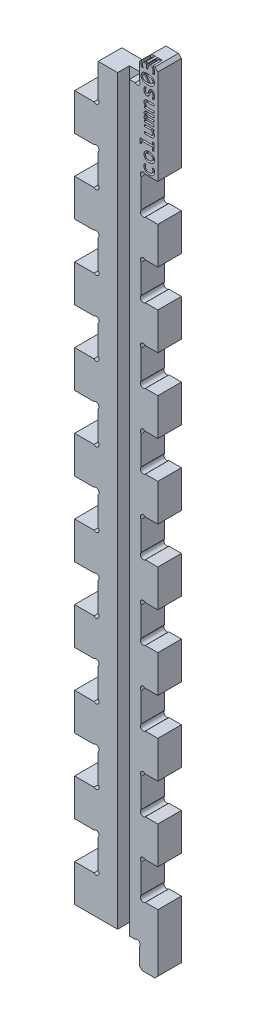
from build123d import *

# Parameters (mm, degrees)
BOSS_EXTRUDE1_DEPTH = 6.35
CUT_EXTRUDE1_DEPTH  = 3.175
CHAMFER1_SIZE       = 0.79375
CUT_EXTRUDE12_DEPTH = 2.54


# Read off the part's stored shape, not the designer's step: Boss-Extrude1
with BuildPart() as part:
    # Boss-Extrude1 outline → Boss-Extrude1 (new body)
    with BuildSketch(Plane.XY):
        with BuildLine():
            Line((22.436796564, 150), (19.069200519, 150))
            ThreePointArc((19.069200519, 150), (17.946668504, 150), (17.946668504, 151.122532015))
            Line((17.946668504, 151.122532015), (17.946668504, 158.877467985))
            ThreePointArc((17.946668504, 158.877467985), (17.946668504, 160), (19.069200519, 160))
            Line((19.069200519, 160), (22.436796564, 160))
            Line((22.436796564, 160), (22.436796564, 170))
            Line((22.436796564, 170), (19.069200519, 170))
            ThreePointArc((19.069200519, 170), (17.946668504, 170), (17.946668504, 171.122532015))
            Line((17.946668504, 171.122532015), (17.946668504, 178.877467985))
            ThreePointArc((17.946668504, 178.877467985), (17.946668504, 180), (19.069200519, 180))
            Line((19.069200519, 180), (22.436796564, 180))
            Line((22.436796564, 180), (22.436796564, 206.35))
            Line((22.436796564, 206.35), (17.436796564, 206.35))
            Line((17.436796564, 206.35), (17.436796564, 201.122532015))
            ThreePointArc((17.436796564, 201.122532015), (17.436796564, 200), (16.314264549, 200))
            Line((16.314264549, 200), (6.35, 200))
            Line((6.35, 200), (6.35, 191.122532015))
            ThreePointArc((6.35, 191.122532015), (6.35, 190), (5.227467985, 190))
            Line((5.227467985, 190), (0, 190))
            Line((0, 190), (0, 180))
            Line((0, 180), (5.227467985, 180))
            ThreePointArc((5.227467985, 180), (6.35, 180), (6.35, 178.877467985))
            Line((6.35, 178.877467985), (6.35, 171.122532015))
            ThreePointArc((6.35, 171.122532015), (6.35, 170), (5.227467985, 170))
            Line((5.227467985, 170), (0, 170))
            Line((0, 170), (0, 160))
            Line((0, 160), (5.227467985, 160))
            ThreePointArc((5.227467985, 160), (6.35, 160), (6.35, 158.877467985))
            Line((6.35, 158.877467985), (6.35, 151.122532015))
            ThreePointArc((6.35, 151.122532015), (6.35, 150), (5.227467985, 150))
            Line((5.227467985, 150), (0, 150))
            Line((0, 150), (0, 140))
            Line((0, 140), (5.227467985, 140))
            ThreePointArc((5.227467985, 140), (6.35, 140), (6.35, 138.877467985))
            Line((6.35, 138.877467985), (6.35, 131.122532015))
            ThreePointArc((6.35, 131.122532015), (6.35, 130), (5.227467985, 130))
            Line((5.227467985, 130), (0, 130))
            Line((0, 130), (0, 120))
            Line((0, 120), (5.227467985, 120))
            ThreePointArc((5.227467985, 120), (6.35, 120), (6.35, 118.877467985))
            Line((6.35, 118.877467985), (6.35, 111.122532015))
            ThreePointArc((6.35, 111.122532015), (6.35, 110), (5.227467985, 110))
            Line((5.227467985, 110), (0, 110))
            Line((0, 110), (0, 100))
            Line((0, 100), (5.227467985, 100))
            ThreePointArc((5.227467985, 100), (6.35, 100), (6.35, 98.877467985))
            Line((6.35, 98.877467985), (6.35, 91.122532015))
            ThreePointArc((6.35, 91.122532015), (6.35, 90), (5.227467985, 90))
            Line((5.227467985, 90), (0, 90))
            Line((0, 90), (0, 80))
            Line((0, 80), (5.227467985, 80))
            ThreePointArc((5.227467985, 80), (6.35, 80), (6.35, 78.877467985))
            Line((6.35, 78.877467985), (6.35, 71.122532015))
            ThreePointArc((6.35, 71.122532015), (6.35, 70), (5.227467985, 70))
            Line((5.227467985, 70), (0, 70))
            Line((0, 70), (0, 60))
            Line((0, 60), (5.227467985, 60))
            ThreePointArc((5.227467985, 60), (6.35, 60), (6.35, 58.877467985))
            Line((6.35, 58.877467985), (6.35, 51.122532015))
            ThreePointArc((6.35, 51.122532015), (6.35, 50), (5.227467985, 50))
            Line((5.227467985, 50), (0, 50))
            Line((0, 50), (0, 40))
            Line((0, 40), (5.227467985, 40))
            ThreePointArc((5.227467985, 40), (6.35, 40), (6.35, 38.877467985))
            Line((6.35, 38.877467985), (6.35, 31.122532015))
            ThreePointArc((6.35, 31.122532015), (6.35, 30), (5.227467985, 30))
            Line((5.227467985, 30), (0, 30))
            Line((0, 30), (0, 20))
            Line((0, 20), (5.227467985, 20))
            ThreePointArc((5.227467985, 20), (6.35, 20), (6.35, 18.877467985))
            Line((6.35, 18.877467985), (6.35, 11.122532015))
            ThreePointArc((6.35, 11.122532015), (6.35, 10), (5.227467985, 10))
            Line((5.227467985, 10), (0, 10))
            Line((0, 10), (0, 0))
            Line((0, 0), (16.314264549, 0))
            ThreePointArc((16.314264549, 0), (17.436796564, 0), (17.436796564, -1.122532015))
            Line((17.436796564, -1.122532015), (17.436796564, -6.35))
            Line((17.436796564, -6.35), (22.436796564, -6.35))
            Line((22.436796564, -6.35), (22.436796564, 10))
            Line((22.436796564, 10), (19.069200519, 10))
            ThreePointArc((19.069200519, 10), (17.946668504, 10), (17.946668504, 11.122532015))
            Line((17.946668504, 11.122532015), (17.946668504, 18.877467985))
            ThreePointArc((17.946668504, 18.877467985), (17.946668504, 20), (19.069200519, 20))
            Line((19.069200519, 20), (22.436796564, 20))
            Line((22.436796564, 20), (22.436796564, 30))
            Line((22.436796564, 30), (19.069200519, 30))
            ThreePointArc((19.069200519, 30), (17.946668504, 30), (17.946668504, 31.122532015))
            Line((17.946668504, 31.122532015), (17.946668504, 38.877467985))
            ThreePointArc((17.946668504, 38.877467985), (17.946668504, 40), (19.069200519, 40))
            Line((19.069200519, 40), (22.436796564, 40))
            Line((22.436796564, 40), (22.436796564, 50))
            Line((22.436796564, 50), (19.069200519, 50))
            ThreePointArc((19.069200519, 50), (17.946668504, 50), (17.946668504, 51.122532015))
            Line((17.946668504, 51.122532015), (17.946668504, 58.877467985))
            ThreePointArc((17.946668504, 58.877467985), (17.946668504, 60), (19.069200519, 60))
            Line((19.069200519, 60), (22.436796564, 60))
            Line((22.436796564, 60), (22.436796564, 70))
            Line((22.436796564, 70), (19.069200519, 70))
            ThreePointArc((19.069200519, 70), (17.946668504, 70), (17.946668504, 71.122532015))
            Line((17.946668504, 71.122532015), (17.946668504, 78.877467985))
            ThreePointArc((17.946668504, 78.877467985), (17.946668504, 80), (19.069200519, 80))
            Line((19.069200519, 80), (22.436796564, 80))
            Line((22.436796564, 80), (22.436796564, 90))
            Line((22.436796564, 90), (19.069200519, 90))
            ThreePointArc((19.069200519, 90), (17.946668504, 90), (17.946668504, 91.122532015))
            Line((17.946668504, 91.122532015), (17.946668504, 98.877467985))
            ThreePointArc((17.946668504, 98.877467985), (17.946668504, 100), (19.069200519, 100))
            Line((19.069200519, 100), (22.436796564, 100))
            Line((22.436796564, 100), (22.436796564, 110))
            Line((22.436796564, 110), (19.069200519, 110))
            ThreePointArc((19.069200519, 110), (17.946668504, 110), (17.946668504, 111.122532015))
            Line((17.946668504, 111.122532015), (17.946668504, 118.877467985))
            ThreePointArc((17.946668504, 118.877467985), (17.946668504, 120), (19.069200519, 120))
            Line((19.069200519, 120), (22.436796564, 120))
            Line((22.436796564, 120), (22.436796564, 130))
            Line((22.436796564, 130), (19.069200519, 130))
            ThreePointArc((19.069200519, 130), (17.946668504, 130), (17.946668504, 131.122532015))
            Line((17.946668504, 131.122532015), (17.946668504, 138.877467985))
            ThreePointArc((17.946668504, 138.877467985), (17.946668504, 140), (19.069200519, 140))
            Line((19.069200519, 140), (22.436796564, 140))
            Line((22.436796564, 140), (22.436796564, 150))
        make_face()
    extrude(amount=BOSS_EXTRUDE1_DEPTH)

    # Sketch2 → Cut-Extrude1 (cut)
    with BuildSketch(Plane.XY.offset(6.35)):
        Polygon((14.771668504, -1.25), (11.596668504, -1.25), (11.596668504, 200), (11.596668504, 201.5875), (14.771668504, 201.5875), (14.771668504, 0), align=None)
    extrude(amount=-CUT_EXTRUDE1_DEPTH, mode=Mode.SUBTRACT)

    # Chamfer1
    chamfer1_edges = [part.edges().sort_by_distance(p)[0] for p in [
        (22.436796564, -6.35, 3.175),
        (17.436796564, -6.35, 3.175),
        (17.436796564, 206.35, 3.175),
        (22.436796564, 206.35, 3.175),
    ]]
    chamfer(chamfer1_edges, length=CHAMFER1_SIZE)

    # Sketch14 → Cut-Extrude12 (cut)
    # profile 1 of 9: a face of its own
    with BuildSketch(Plane.XY.offset(6.35)):
        with BuildLine():
            add(Edge.make_bspline(
                [(21.413507164, 182.485507246), (21.429646152, 182.424711919), (21.462077349, 182.302544081), (21.491344746, 182.113463173), (21.511549887, 181.919789717), (21.513811882, 181.788627363), (21.514956439, 181.722259964)],
                knots=[0, 0, 0, 0, 0.976697248, 1.962667147, 2.969121252, 4, 4, 4, 4], degree=3))
            add(Edge.make_bspline(
                [(21.514956439, 181.722259964), (21.513856896, 181.670971568), (21.511720288, 181.571309086), (21.496171474, 181.426117733), (21.468100047, 181.290207265), (21.430646575, 181.16273982), (21.381129837, 181.044932194), (21.321612414, 180.935690492), (21.249545502, 180.836512901), (21.167985839, 180.745554843), (21.075234468, 180.665092554), (20.972450312, 180.594873737), (20.859204012, 180.536265874), (20.735843311, 180.488477683), (20.602719103, 180.451821331), (20.459645243, 180.424622267), (20.30663064, 180.409018868), (20.201170796, 180.406890726), (20.146976367, 180.405797101)],
                knots=[0, 0, 0, 0, 1.13631222, 2.208056892, 3.229751581, 4.207543962, 5.146802535, 6.055901307, 6.957506756, 7.856829175, 8.757141617, 9.671201812, 10.608488455, 11.575923842, 12.597065045, 13.663569899, 14.799339237, 16, 16, 16, 16], degree=3))
            add(Edge.make_bspline(
                [(20.146976367, 180.405797101), (20.094614731, 180.407038532), (19.991943847, 180.409472734), (19.84148827, 180.427887707), (19.698494066, 180.458688753), (19.563422639, 180.501479962), (19.437057822, 180.555355232), (19.319710197, 180.619914596), (19.211656475, 180.694575413), (19.112855118, 180.778767105), (19.024513864, 180.872527317), (18.947525343, 180.975510658), (18.880221228, 181.086553858), (18.824205356, 181.206095633), (18.779623019, 181.333248263), (18.748120369, 181.467131699), (18.728565171, 181.607287035), (18.726269809, 181.702909174), (18.725101367, 181.751585145)],
                knots=[0, 0, 0, 0, 1.14172334, 2.238695217, 3.299842855, 4.327537934, 5.323891298, 6.290910086, 7.243436865, 8.183333826, 9.116727336, 10.04664683, 10.982384661, 11.943757178, 12.920442466, 13.915445565, 14.938868004, 16, 16, 16, 16], degree=3))
            add(Edge.make_bspline(
                [(18.725101367, 181.751585145), (18.726388209, 181.818727859), (18.728875289, 181.948494565), (18.746046673, 182.137494242), (18.776997368, 182.315988423), (18.810176374, 182.429491842), (18.826550642, 182.485507246)],
                knots=[0, 0, 0, 0, 1.083157279, 2.093417771, 3.059077019, 4, 4, 4, 4], degree=3))
            Line((18.826550642, 182.485507246), (19.283072381, 182.485507246))
            add(Edge.make_bspline(
                [(19.283072381, 182.485507246), (19.258977416, 182.428672532), (19.211243765, 182.316079368), (19.164033448, 182.138882658), (19.136675631, 181.957470002), (19.132837361, 181.834900364), (19.130898468, 181.772984601)],
                knots=[0, 0, 0, 0, 1.008011837, 1.996935199, 2.988156546, 4, 4, 4, 4], degree=3))
            add(Edge.make_bspline(
                [(19.130898468, 181.772984601), (19.13149147, 181.744122764), (19.132673274, 181.686603441), (19.147343327, 181.602138563), (19.167183477, 181.519414748), (19.197803513, 181.440486505), (19.235603895, 181.364796787), (19.282322509, 181.294130788), (19.335064383, 181.226978153), (19.396946446, 181.166145792), (19.46462759, 181.109327572), (19.54086278, 181.06064088), (19.622908437, 181.016289736), (19.712515322, 180.979620743), (19.808454511, 180.948682018), (19.911279726, 180.929370481), (20.019477541, 180.914612476), (20.093818023, 180.913575122), (20.13191749, 180.913043478)],
                knots=[0, 0, 0, 0, 0.936931327, 1.867228869, 2.779398487, 3.697971634, 4.611917788, 5.524087406, 6.446705122, 7.381745884, 8.339342578, 9.313428399, 10.316048635, 11.366925265, 12.455944006, 13.58589901, 14.762774236, 16, 16, 16, 16], degree=3))
            add(Edge.make_bspline(
                [(20.13191749, 180.913043478), (20.171564423, 180.913909478), (20.248353722, 180.915586772), (20.35971831, 180.925471169), (20.463079203, 180.943713113), (20.558878752, 180.969003325), (20.647101159, 181.001378477), (20.72808528, 181.04081261), (20.800333011, 181.089097754), (20.866196596, 181.142821863), (20.923087398, 181.204561397), (20.97348119, 181.271203989), (21.015731225, 181.343874761), (21.049719125, 181.422220986), (21.076897812, 181.505751692), (21.095721959, 181.595012329), (21.106820175, 181.689747148), (21.108366458, 181.754725061), (21.109159338, 181.788043478)],
                knots=[0, 0, 0, 0, 1.272546493, 2.464703921, 3.584083793, 4.637111423, 5.64042409, 6.595989051, 7.520192865, 8.423428206, 9.317262299, 10.207550376, 11.100459029, 12.007863446, 12.943662776, 13.914861663, 14.930813474, 16, 16, 16, 16], degree=3))
            add(Edge.make_bspline(
                [(21.109159338, 181.788043478), (21.10738724, 181.849192548), (21.103877038, 181.970317713), (21.0741389, 182.14858532), (21.027445297, 182.321560971), (20.980509306, 182.430771798), (20.956985425, 182.485507246)],
                knots=[0, 0, 0, 0, 1.019427626, 2.019300384, 3.007291806, 4, 4, 4, 4], degree=3))
            Line((20.956985425, 182.485507246), (21.413507164, 182.485507246))
        make_face()
    # profile 2 of 9: a face of its own
    with BuildSketch(Plane.XY.offset(6.35)):
        with BuildLine():
            add(Edge.make_bspline(
                [(20.098629446, 185.782608696), (20.149928894, 185.78158166), (20.250692643, 185.779564329), (20.398344109, 185.762571062), (20.539438263, 185.735005856), (20.673327516, 185.696146129), (20.799657147, 185.647454074), (20.916719521, 185.587440787), (21.024977872, 185.51880535), (21.123161125, 185.439654611), (21.211337395, 185.351428085), (21.289883784, 185.254322042), (21.356403784, 185.146850926), (21.41367794, 185.031412914), (21.459058863, 184.907070692), (21.491342659, 184.774462957), (21.511747676, 184.633747926), (21.51387058, 184.537020889), (21.514956439, 184.48754529)],
                knots=[0, 0, 0, 0, 1.137682146, 2.234665757, 3.292064677, 4.323284341, 5.323444728, 6.290591528, 7.236753627, 8.16208614, 9.082058246, 9.999151167, 10.926004237, 11.880028938, 12.853388225, 13.855469823, 14.903079009, 16, 16, 16, 16], degree=3))
            add(Edge.make_bspline(
                [(21.514956439, 184.48754529), (21.5139342, 184.440206537), (21.511940151, 184.347864322), (21.495137476, 184.212998505), (21.466723584, 184.085847668), (21.427094603, 183.966623013), (21.376972909, 183.855391745), (21.316025022, 183.75282742), (21.243689638, 183.659398891), (21.162013437, 183.573784384), (21.068610827, 183.498620736), (20.965241844, 183.432262247), (20.851690878, 183.375046764), (20.727139385, 183.328667436), (20.593327029, 183.291272644), (20.449223764, 183.265523075), (20.295813508, 183.249539562), (20.190080229, 183.247448639), (20.135880352, 183.246376812)],
                knots=[0, 0, 0, 0, 1.077482312, 2.101810833, 3.088247346, 4.039279708, 4.957210705, 5.860841599, 6.748700475, 7.642023149, 8.548532111, 9.471180557, 10.434177725, 11.437361354, 12.492450218, 13.593169009, 14.76623572, 16, 16, 16, 16], degree=3))
            add(Edge.make_bspline(
                [(20.135880352, 183.246376812), (20.084580452, 183.247395528), (19.984078398, 183.249391303), (19.836950248, 183.266405431), (19.69665767, 183.294006048), (19.563750311, 183.33267469), (19.438582337, 183.38168436), (19.322757104, 183.441640003), (19.214718157, 183.509506335), (19.116963101, 183.588602567), (19.028385723, 183.676764091), (18.950525738, 183.774836569), (18.88290835, 183.881696915), (18.825325086, 183.997196574), (18.780139491, 184.121591214), (18.748956682, 184.254642184), (18.728242793, 184.395222123), (18.726164439, 184.491959387), (18.725101367, 184.541440217)],
                knots=[0, 0, 0, 0, 1.140165783, 2.23370814, 3.287654293, 4.315485483, 5.306894427, 6.270924538, 7.211041269, 8.138393845, 9.060374312, 9.984055593, 10.916064858, 11.866908198, 12.847911069, 13.850788169, 14.900684357, 16, 16, 16, 16], degree=3))
            add(Edge.make_bspline(
                [(18.725101367, 184.541440217), (18.726138595, 184.588774494), (18.728161885, 184.681107979), (18.744724575, 184.815779693), (18.773770338, 184.942382546), (18.811858811, 185.062160689), (18.863282967, 185.172947018), (18.923022902, 185.276442429), (18.995651008, 185.369299477), (19.076394312, 185.455189983), (19.169154124, 185.530609907), (19.272314075, 185.596456426), (19.38534147, 185.654179465), (19.509549702, 185.700111985), (19.643231015, 185.737977967), (19.786910809, 185.763211548), (19.939739193, 185.779524083), (20.044689945, 185.781561542), (20.098629446, 185.782608696)],
                knots=[0, 0, 0, 0, 1.079837612, 2.106405242, 3.089117945, 4.040340163, 4.968261396, 5.870792832, 6.760592503, 7.651698004, 8.555516875, 9.480182165, 10.439904144, 11.445280661, 12.496869516, 13.605924118, 14.769563276, 16, 16, 16, 16], degree=3))
        make_face()
        with BuildLine():
            add(Edge.make_bspline(
                [(20.118443758, 185.275362319), (20.078523368, 185.274888358), (20.001444505, 185.273973228), (19.889491628, 185.263133431), (19.785326787, 185.247065472), (19.688552654, 185.224039838), (19.599788238, 185.194740572), (19.518226239, 185.16018196), (19.444874103, 185.118545277), (19.37895209, 185.071874763), (19.320050824, 185.019875023), (19.269457285, 184.961901027), (19.226023416, 184.898753776), (19.191173469, 184.830177651), (19.164312848, 184.757214262), (19.145272418, 184.679854827), (19.13307589, 184.598628955), (19.131631185, 184.542805133), (19.130898468, 184.514492754)],
                knots=[0, 0, 0, 0, 1.356519224, 2.619186811, 3.819509988, 4.936913966, 5.996184945, 6.99377994, 7.942819649, 8.857324597, 9.735111911, 10.606953056, 11.466309403, 12.333838493, 13.214652511, 14.103305864, 15.038046444, 16, 16, 16, 16], degree=3))
            add(Edge.make_bspline(
                [(19.130898468, 184.514492754), (19.131564114, 184.481909957), (19.132855377, 184.418703668), (19.14987618, 184.327967971), (19.173429934, 184.243450279), (19.209713079, 184.167355229), (19.254151625, 184.098492957), (19.304575528, 184.035387152), (19.363437182, 183.979929015), (19.427441679, 183.929513333), (19.498577165, 183.886852233), (19.57499167, 183.850674576), (19.656379806, 183.81909919), (19.74314869, 183.795522138), (19.833556393, 183.775874383), (19.926720155, 183.764445356), (20.021801413, 183.754388409), (20.085918653, 183.753880724), (20.118443758, 183.753623188)],
                knots=[0, 0, 0, 0, 1.110637689, 2.154489307, 3.141878424, 4.098089287, 5.018763327, 5.935719245, 6.84787245, 7.773348928, 8.712219521, 9.67229302, 10.657166387, 11.687883328, 12.738569762, 13.812532751, 14.89035145, 16, 16, 16, 16], degree=3))
            add(Edge.make_bspline(
                [(20.118443758, 183.753623188), (20.158361186, 183.754125952), (20.235960619, 183.755103325), (20.348215106, 183.765640971), (20.452846842, 183.782111664), (20.549900727, 183.80496103), (20.639272156, 183.834070394), (20.721225789, 183.868971805), (20.794727265, 183.910377055), (20.861682965, 183.956152969), (20.919367282, 184.009213362), (20.971016369, 184.066016615), (21.012918828, 184.129577947), (21.047931694, 184.197324717), (21.076394791, 184.269890718), (21.094373111, 184.347647216), (21.107184143, 184.429531478), (21.10848861, 184.485641963), (21.109159338, 184.514492754)],
                knots=[0, 0, 0, 0, 1.353436926, 2.63107981, 3.819827699, 4.943407898, 6.008783481, 7.004111729, 7.958805456, 8.866070606, 9.747847192, 10.610990163, 11.463369748, 12.320960703, 13.194550705, 14.098580282, 15.02233135, 16, 16, 16, 16], degree=3))
            add(Edge.make_bspline(
                [(21.109159338, 184.514492754), (21.108376586, 184.547053657), (21.106859225, 184.610172895), (21.091439129, 184.701238881), (21.066573916, 184.785234151), (21.029955864, 184.861122204), (20.986186379, 184.930419732), (20.935401457, 184.993512186), (20.876922388, 185.049189243), (20.81209752, 185.09845625), (20.741774437, 185.142334054), (20.665020735, 185.178248247), (20.583685241, 185.209867552), (20.496679882, 185.233682095), (20.406121286, 185.252564541), (20.312432858, 185.266142893), (20.216338189, 185.274159571), (20.151218551, 185.274959642), (20.118443758, 185.275362319)],
                knots=[0, 0, 0, 0, 1.10814016, 2.148127254, 3.135881691, 4.081802165, 5.007999381, 5.922893309, 6.832995325, 7.750893548, 8.692352109, 9.650266659, 10.632925307, 11.66132444, 12.718455334, 13.782343566, 14.883850839, 16, 16, 16, 16], degree=3))
        make_face(mode=Mode.SUBTRACT)
    # profile 3 of 9: a face of its own
    with BuildSketch(Plane.XY.offset(6.35)):
        Polygon((18.065681077, 187.304347826), (18.065681077, 186.543478261), (17.659883975, 186.543478261), (17.659883975, 187.811594203), (21.0584347, 187.811594203), (21.0584347, 188.572463768), (21.464231801, 188.572463768), (21.464231801, 186.442028986), (21.0584347, 186.442028986), (21.0584347, 187.304347826), align=None)
    # profile 4 of 9: a face of its own
    with BuildSketch(Plane.XY.offset(6.35)):
        with BuildLine():
            Line((21.464231801, 191.565217391), (21.464231801, 191.110280797))
            Line((21.464231801, 191.110280797), (21.030694664, 191.092844203))
            add(Edge.make_bspline(
                [(21.030694664, 191.092844203), (21.053299903, 191.073461681), (21.09705005, 191.035948775), (21.158359007, 190.978543884), (21.213789088, 190.922632447), (21.277951941, 190.850952495), (21.347811564, 190.763927611), (21.413429745, 190.656342716), (21.463372308, 190.549506837), (21.494048452, 190.440155251), (21.512139851, 190.328108991), (21.514003687, 190.251996046), (21.514956439, 190.213088768)],
                knots=[0, 0, 0, 0, 0.857041526, 1.65871694, 2.416941668, 3.122378847, 4.427667761, 5.622358466, 6.742009012, 7.810626984, 8.880840251, 10, 10, 10, 10], degree=3))
            add(Edge.make_bspline(
                [(21.514956439, 190.213088768), (21.514186608, 190.179767566), (21.512697402, 190.115309034), (21.50147804, 190.021643699), (21.482957991, 189.934386696), (21.455466803, 189.853565197), (21.421686776, 189.778503917), (21.379361301, 189.709754928), (21.329025215, 189.647701481), (21.2714755, 189.591606153), (21.206235371, 189.542355078), (21.132818293, 189.500108133), (21.052217238, 189.46367016), (20.963366924, 189.434614301), (20.867204584, 189.411400603), (20.762896312, 189.396451206), (20.651022625, 189.385413492), (20.573675008, 189.38451944), (20.533751729, 189.384057971)],
                knots=[0, 0, 0, 0, 1.087785528, 2.104277609, 3.075507797, 3.994819673, 4.886518758, 5.757958902, 6.622884796, 7.48914323, 8.375946856, 9.284388073, 10.249623431, 11.258952501, 12.33231048, 13.475466952, 14.696952255, 16, 16, 16, 16], degree=3))
            Line((20.533751729, 189.384057971), (18.775826004, 189.384057971))
            Line((18.775826004, 189.384057971), (18.775826004, 189.891304348))
            Line((18.775826004, 189.891304348), (20.491745388, 189.891304348))
            add(Edge.make_bspline(
                [(20.491745388, 189.891304348), (20.516591582, 189.891521189), (20.565029673, 189.891943925), (20.635128487, 189.897712942), (20.700511233, 189.906260474), (20.760880419, 189.918127928), (20.816713889, 189.932890876), (20.867721251, 189.951922659), (20.913742556, 189.974718743), (20.954635234, 190.001431315), (20.99137069, 190.030301054), (21.022698058, 190.063681857), (21.049925424, 190.099801399), (21.071051105, 190.140263007), (21.089202283, 190.183205509), (21.100508892, 190.230322405), (21.107957014, 190.280745511), (21.108749683, 190.31556494), (21.109159338, 190.333559783)],
                knots=[0, 0, 0, 0, 1.379482231, 2.689324916, 3.903207566, 5.03979223, 6.103994373, 7.10685688, 8.058278418, 8.949535843, 9.815682373, 10.645916616, 11.485176811, 12.318904069, 13.174422631, 14.067610232, 15.001332013, 16, 16, 16, 16], degree=3))
            add(Edge.make_bspline(
                [(21.109159338, 190.333559783), (21.107955241, 190.360618186), (21.105563726, 190.414360176), (21.085337666, 190.494976879), (21.049231493, 190.576304059), (20.993289282, 190.660049607), (20.918723086, 190.749633025), (20.8400473, 190.824631321), (20.767507711, 190.890565505), (20.703454547, 190.943812004), (20.632563823, 191.000612027), (20.582213534, 191.038305046), (20.555943758, 191.057971014)],
                knots=[0, 0, 0, 0, 0.858155544, 1.704423788, 2.62077838, 3.670024691, 4.89106605, 6.314526741, 7.116271201, 8.003329472, 8.958256453, 10, 10, 10, 10], degree=3))
            Line((20.555943758, 191.057971014), (18.775826004, 191.057971014))
            Line((18.775826004, 191.057971014), (18.775826004, 191.565217391))
            Line((18.775826004, 191.565217391), (21.464231801, 191.565217391))
        make_face()
    # profile 5 of 9: a face of its own
    with BuildSketch(Plane.XY.offset(6.35)):
        with BuildLine():
            Line((21.464231801, 194.304347826), (19.546206439, 194.304347826))
            add(Edge.make_bspline(
                [(19.546206439, 194.304347826), (19.508148611, 194.303950382), (19.439630536, 194.303234837), (19.347273139, 194.297078765), (19.274029528, 194.287752634), (19.218032922, 194.272555985), (19.176230475, 194.252750242), (19.147765599, 194.226697059), (19.13318363, 194.192800558), (19.131697314, 194.16895368), (19.130898468, 194.156136775)],
                knots=[0, 0, 0, 0, 1.876556353, 3.378491021, 4.56325376, 5.511765752, 6.228468968, 6.827369418, 7.36975005, 8, 8, 8, 8], degree=3))
            add(Edge.make_bspline(
                [(19.130898468, 194.156136775), (19.132416276, 194.140481198), (19.135504649, 194.108625861), (19.163226718, 194.06354791), (19.208033838, 194.021311398), (19.257405643, 193.986059191), (19.306710104, 193.955775518), (19.351906147, 193.931869776), (19.402113899, 193.905220163), (19.458489596, 193.87764161), (19.521440983, 193.848193142), (19.591241491, 193.816921356), (19.667092461, 193.781465015), (19.720508956, 193.758388311), (19.748312417, 193.746376812)],
                knots=[0, 0, 0, 0, 0.729562897, 1.484485128, 2.413589845, 3.61111441, 4.323305539, 5.12759957, 6.009182577, 6.990408454, 8.07175806, 9.269988125, 10.579019869, 12, 12, 12, 12], degree=3))
            Line((19.748312417, 193.746376812), (21.464231801, 193.746376812))
            Line((21.464231801, 193.746376812), (21.464231801, 193.239130435))
            Line((21.464231801, 193.239130435), (19.596138504, 193.239130435))
            add(Edge.make_bspline(
                [(19.596138504, 193.239130435), (19.572887814, 193.238948154), (19.529023114, 193.238604264), (19.466412752, 193.236864221), (19.410865821, 193.235009783), (19.34925788, 193.22958629), (19.285434992, 193.222747542), (19.22333188, 193.20745675), (19.177678642, 193.18755944), (19.147432969, 193.159916552), (19.133580881, 193.125051578), (19.131817955, 193.101056665), (19.130898468, 193.088541667)],
                knots=[0, 0, 0, 0, 1.29831334, 2.449394988, 3.497764777, 4.400691891, 5.902997146, 7.076641074, 7.960813511, 8.659813197, 9.301000314, 10, 10, 10, 10], degree=3))
            add(Edge.make_bspline(
                [(19.130898468, 193.088541667), (19.132093623, 193.07430847), (19.134535245, 193.045230975), (19.157304813, 193.002462838), (19.197835341, 192.961046157), (19.244595333, 192.926767623), (19.292626035, 192.896982157), (19.336947371, 192.87191926), (19.38723111, 192.844601369), (19.444399085, 192.816208153), (19.508980077, 192.786048363), (19.581496444, 192.753561611), (19.661965228, 192.717901721), (19.718689948, 192.69376432), (19.748312417, 192.68115942)],
                knots=[0, 0, 0, 0, 0.664834964, 1.358214545, 2.218452452, 3.369512681, 4.07160188, 4.871606883, 5.759566004, 6.758032602, 7.867786569, 9.105782755, 10.488597914, 12, 12, 12, 12], degree=3))
            Line((19.748312417, 192.68115942), (21.464231801, 192.68115942))
            Line((21.464231801, 192.68115942), (21.464231801, 192.173913043))
            Line((21.464231801, 192.173913043), (18.775826004, 192.173913043))
            Line((18.775826004, 192.173913043), (18.775826004, 192.595561594))
            Line((18.775826004, 192.595561594), (19.287035243, 192.620923913))
            add(Edge.make_bspline(
                [(19.287035243, 192.620923913), (19.239508284, 192.643698792), (19.151017248, 192.686103623), (19.030355218, 192.752493067), (18.931201785, 192.81937967), (18.853193606, 192.889918223), (18.794132149, 192.964139784), (18.753059053, 193.044008919), (18.729508641, 193.131060837), (18.726598361, 193.191432391), (18.725101367, 193.222486413)],
                knots=[0, 0, 0, 0, 1.442431336, 2.685680846, 3.766898407, 4.708676083, 5.553507341, 6.349116777, 7.150815901, 8, 8, 8, 8], degree=3))
            add(Edge.make_bspline(
                [(18.725101367, 193.222486413), (18.726525437, 193.257029922), (18.729248025, 193.323071419), (18.756675793, 193.415390003), (18.802203914, 193.494632889), (18.855681121, 193.547834562), (18.905802649, 193.583556282), (18.949375973, 193.606565688), (18.997418602, 193.626218098), (19.050570402, 193.642009327), (19.10802793, 193.65466786), (19.170597505, 193.663055775), (19.237784433, 193.668894836), (19.284379465, 193.669292159), (19.3084347, 193.669497283)],
                knots=[0, 0, 0, 0, 1.480005216, 2.829526133, 4.090306251, 5.365750341, 6.033031342, 6.728361887, 7.476213735, 8.258546705, 9.10632501, 9.999921807, 10.967436031, 12, 12, 12, 12], degree=3))
            add(Edge.make_bspline(
                [(19.3084347, 193.669497283), (19.264458674, 193.690908716), (19.1805232, 193.731775955), (19.062755859, 193.793957451), (18.961358617, 193.859047027), (18.876046478, 193.928429936), (18.810281084, 194.006587204), (18.768088639, 194.077489897), (18.746643666, 194.138882772), (18.73326162, 194.187717018), (18.726474098, 194.24022251), (18.725566587, 194.276328041), (18.725101367, 194.294836957)],
                knots=[0, 0, 0, 0, 1.60985852, 3.072679605, 4.379817855, 5.571026594, 6.67542271, 7.726937151, 8.263282642, 8.811616546, 9.390794494, 10, 10, 10, 10], degree=3))
            add(Edge.make_bspline(
                [(18.725101367, 194.294836957), (18.725769095, 194.31573187), (18.727068354, 194.356388978), (18.7354553, 194.415625799), (18.751480435, 194.47037016), (18.773330217, 194.521017425), (18.79987008, 194.568229819), (18.834169021, 194.610620973), (18.8736026, 194.649805766), (18.920250082, 194.683658591), (18.972202161, 194.714109516), (19.030470465, 194.740140247), (19.094954046, 194.762245563), (19.16549496, 194.780248188), (19.24176127, 194.794342967), (19.324026574, 194.804888752), (19.41246534, 194.809853917), (19.473549809, 194.811002815), (19.504992671, 194.811594203)],
                knots=[0, 0, 0, 0, 0.945901948, 1.840526258, 2.699599065, 3.519232278, 4.333526944, 5.142182627, 5.979336698, 6.84272648, 7.743086642, 8.701080884, 9.725927667, 10.825164815, 11.993149719, 13.234608006, 14.576531152, 16, 16, 16, 16], degree=3))
            Line((19.504992671, 194.811594203), (21.464231801, 194.811594203))
            Line((21.464231801, 194.811594203), (21.464231801, 194.304347826))
        make_face()
    # profile 6 of 9: a face of its own
    with BuildSketch(Plane.XY.offset(6.35)):
        with BuildLine():
            Line((18.775826004, 195.369565217), (18.775826004, 195.821331522))
            Line((18.775826004, 195.821331522), (19.209363142, 195.841938406))
            add(Edge.make_bspline(
                [(19.209363142, 195.841938406), (19.186710248, 195.861003344), (19.142744173, 195.898005702), (19.081997904, 195.955486797), (19.026054246, 196.010602059), (18.961916674, 196.082184001), (18.893862846, 196.170444954), (18.826169895, 196.276296402), (18.777671642, 196.383710512), (18.745726298, 196.492883639), (18.728163923, 196.604863924), (18.726128039, 196.680420996), (18.725101367, 196.718523551)],
                knots=[0, 0, 0, 0, 0.854410729, 1.658290848, 2.413189534, 3.120566751, 4.430777517, 5.626275647, 6.738912042, 7.819923861, 8.900612878, 10, 10, 10, 10], degree=3))
            add(Edge.make_bspline(
                [(18.725101367, 196.718523551), (18.725890025, 196.751841384), (18.727421862, 196.816555763), (18.738451724, 196.910525856), (18.757329497, 196.998196913), (18.78419985, 197.079648086), (18.819360375, 197.154483393), (18.861422335, 197.223472345), (18.911842027, 197.28548985), (18.969373934, 197.341586065), (19.035072753, 197.391227183), (19.108930293, 197.433408959), (19.189952857, 197.470504106), (19.278703687, 197.500215412), (19.375491807, 197.523441596), (19.479817057, 197.538209367), (19.591672051, 197.549416128), (19.668759142, 197.550278171), (19.708683794, 197.550724638)],
                knots=[0, 0, 0, 0, 1.084895162, 2.107229392, 3.075878915, 4.000906046, 4.893849023, 5.762973654, 6.625601345, 7.489558035, 8.374005326, 9.299232485, 10.254066813, 11.271611206, 12.342117155, 13.490741827, 14.700414596, 16, 16, 16, 16], degree=3))
            Line((19.708683794, 197.550724638), (21.464231801, 197.550724638))
            Line((21.464231801, 197.550724638), (21.464231801, 197.043478261))
            Line((21.464231801, 197.043478261), (19.74910499, 197.043478261))
            add(Edge.make_bspline(
                [(19.74910499, 197.043478261), (19.723730974, 197.043265254), (19.674502152, 197.042851992), (19.603339802, 197.037091144), (19.537196421, 197.028436739), (19.475867291, 197.016915169), (19.419763259, 197.000971658), (19.368505609, 196.982341933), (19.323034805, 196.958989105), (19.282294054, 196.932837531), (19.24610001, 196.903333387), (19.215007947, 196.870087301), (19.189622163, 196.832849132), (19.167717404, 196.793000387), (19.151289444, 196.749179056), (19.13943576, 196.702129404), (19.132131947, 196.651646463), (19.131318738, 196.61683555), (19.130898468, 196.598845109)],
                knots=[0, 0, 0, 0, 1.402829076, 2.721667091, 3.944869442, 5.09095765, 6.168609952, 7.167208006, 8.101539423, 8.989006971, 9.840135635, 10.677485559, 11.496146598, 12.326328613, 13.186437782, 14.075827298, 15.005578631, 16, 16, 16, 16], degree=3))
            add(Edge.make_bspline(
                [(19.130898468, 196.598845109), (19.132139813, 196.571798659), (19.134617094, 196.517823575), (19.154358602, 196.437019734), (19.191083027, 196.356401643), (19.245492746, 196.272591157), (19.322515546, 196.185649504), (19.399174662, 196.108698371), (19.47358083, 196.04481889), (19.536443256, 195.990798035), (19.606626127, 195.934420365), (19.656032799, 195.896525944), (19.68173633, 195.876811594)],
                knots=[0, 0, 0, 0, 0.861448011, 1.719143497, 2.631313462, 3.672944429, 4.89121589, 6.326054317, 7.131579175, 8.015608799, 8.967632108, 10, 10, 10, 10], degree=3))
            Line((19.68173633, 195.876811594), (21.464231801, 195.876811594))
            Line((21.464231801, 195.876811594), (21.464231801, 195.369565217))
            Line((21.464231801, 195.369565217), (18.775826004, 195.369565217))
        make_face()
    # profile 7 of 9: a face of its own
    with BuildSketch(Plane.XY.offset(6.35)):
        with BuildLine():
            add(Edge.make_bspline(
                [(20.731894845, 200.543478261), (20.754905782, 200.5428205), (20.800038267, 200.541530401), (20.865935318, 200.532865085), (20.928229967, 200.517975545), (21.005039292, 200.489026343), (21.094604303, 200.441459809), (21.188260274, 200.364788586), (21.27024637, 200.274300212), (21.337777001, 200.169702845), (21.393394856, 200.05526305), (21.439451873, 199.934061144), (21.474176091, 199.807401661), (21.497188572, 199.677853795), (21.512161714, 199.548093399), (21.514030337, 199.46165662), (21.514956439, 199.418817935)],
                knots=[0, 0, 0, 0, 0.633261957, 1.242047899, 1.825784691, 2.391724496, 3.497806391, 4.599313968, 5.706184275, 6.845628997, 8.01303465, 9.202780299, 10.40936005, 11.621622792, 12.82125928, 14, 14, 14, 14], degree=3))
            add(Edge.make_bspline(
                [(21.514956439, 199.418817935), (21.514424469, 199.3739008), (21.513385025, 199.286134791), (21.507462293, 199.157046186), (21.495191971, 199.033633613), (21.474433821, 198.876477913), (21.436320293, 198.684876352), (21.387327326, 198.537567712), (21.362782526, 198.463768116)],
                knots=[0, 0, 0, 0, 0.8318041, 1.625306855, 2.39201053, 3.127486267, 4.560910269, 6, 6, 6, 6], degree=3))
            Line((21.362782526, 198.463768116), (20.956985425, 198.463768116))
            add(Edge.make_bspline(
                [(20.956985425, 198.463768116), (20.980150272, 198.540859798), (21.025990965, 198.693415786), (21.072539221, 198.92575508), (21.103820444, 199.156414784), (21.107390126, 199.310135272), (21.109159338, 199.386322464)],
                knots=[0, 0, 0, 0, 1.028621383, 2.035528973, 3.026365761, 4, 4, 4, 4], degree=3))
            add(Edge.make_bspline(
                [(21.109159338, 199.386322464), (21.108785475, 199.413008119), (21.108059541, 199.464823957), (21.104482881, 199.539705632), (21.09701271, 199.609197193), (21.088046357, 199.673352996), (21.075175492, 199.73203902), (21.060336908, 199.785682988), (21.042383331, 199.833756473), (21.015453552, 199.888644277), (20.976571197, 199.947116646), (20.9164928, 199.999090105), (20.84559468, 200.0305274), (20.795084906, 200.03429635), (20.769145751, 200.036231884)],
                knots=[0, 0, 0, 0, 1.177034072, 2.285460366, 3.304552027, 4.25862572, 5.140761872, 5.952196242, 6.711782318, 7.399616765, 8.647200084, 9.779557455, 10.859697841, 12, 12, 12, 12], degree=3))
            add(Edge.make_bspline(
                [(20.769145751, 200.036231884), (20.746300876, 200.035063255), (20.701870781, 200.032790434), (20.637462379, 200.013333654), (20.578062553, 199.975989327), (20.534343034, 199.92974762), (20.500896205, 199.881434627), (20.473962877, 199.835021068), (20.446452816, 199.779694167), (20.41870149, 199.714401183), (20.389095217, 199.638635765), (20.358801375, 199.550583241), (20.324942491, 199.450447144), (20.303419025, 199.378996358), (20.292017128, 199.341145833)],
                knots=[0, 0, 0, 0, 0.907345476, 1.764660391, 2.642141199, 3.667351492, 4.270644915, 4.976917717, 5.799077655, 6.726036525, 7.797049226, 9.033004306, 10.428255989, 12, 12, 12, 12], degree=3))
            add(Edge.make_bspline(
                [(20.292017128, 199.341145833), (20.273446254, 199.283831044), (20.237269273, 199.172179), (20.182732682, 199.038278309), (20.134862589, 198.939101537), (20.095930252, 198.871099122), (20.052832702, 198.808845199), (20.007991433, 198.750299902), (19.958803408, 198.698101695), (19.905980792, 198.651308169), (19.848623249, 198.611047986), (19.787481316, 198.575683965), (19.721186069, 198.547317349), (19.648713565, 198.528881553), (19.571197217, 198.516565575), (19.517460356, 198.515194886), (19.489933794, 198.514492754)],
                knots=[0, 0, 0, 0, 2.026922514, 3.948545256, 4.85901426, 5.731224239, 6.581920903, 7.405283517, 8.210300511, 8.991400753, 9.775782414, 10.564183993, 11.36496843, 12.193020971, 13.074379862, 14, 14, 14, 14], degree=3))
            add(Edge.make_bspline(
                [(19.489933794, 198.514492754), (19.470597084, 198.515049235), (19.430867208, 198.516192601), (19.370323105, 198.527777669), (19.306742923, 198.543126625), (19.241312622, 198.566144059), (19.175293706, 198.596572457), (19.111474268, 198.637860963), (19.049897078, 198.687831241), (18.990280714, 198.746864989), (18.936063528, 198.817391664), (18.884487335, 198.897728413), (18.84053874, 198.990484081), (18.798076166, 199.092898224), (18.765039776, 199.208723937), (18.741799401, 199.3377253), (18.72752026, 199.480054726), (18.725930481, 199.579410503), (18.725101367, 199.631227355)],
                knots=[0, 0, 0, 0, 0.61451694, 1.262607855, 1.955737479, 2.694746519, 3.465575442, 4.263028973, 5.105796601, 5.98544015, 6.925383873, 7.930421828, 9.016805536, 10.185885914, 11.45477201, 12.83960349, 14.351763713, 16, 16, 16, 16], degree=3))
            add(Edge.make_bspline(
                [(18.725101367, 199.631227355), (18.726329602, 199.687530195), (18.728911859, 199.805901933), (18.745867017, 199.990794577), (18.776823291, 200.18857871), (18.809688575, 200.32256203), (18.826550642, 200.391304348)],
                knots=[0, 0, 0, 0, 0.878797129, 1.847593187, 2.895672736, 4, 4, 4, 4], degree=3))
            Line((18.826550642, 200.391304348), (19.232347743, 200.391304348))
            add(Edge.make_bspline(
                [(19.232347743, 200.391304348), (19.216447978, 200.320664965), (19.18568439, 200.183988676), (19.159546082, 200.014166222), (19.143869803, 199.88635126), (19.137303373, 199.798513627), (19.131845217, 199.717155966), (19.131206324, 199.665052232), (19.130898468, 199.639945652)],
                knots=[0, 0, 0, 0, 1.715110988, 3.318474709, 4.068510855, 4.76561266, 5.405201082, 6, 6, 6, 6], degree=3))
            add(Edge.make_bspline(
                [(19.130898468, 199.639945652), (19.131182058, 199.612463121), (19.131727885, 199.559567299), (19.136422935, 199.483640991), (19.144272101, 199.414321064), (19.154996072, 199.351469025), (19.169823165, 199.29510507), (19.1849339, 199.243807232), (19.204388077, 199.198817203), (19.230289855, 199.1471173), (19.270594797, 199.095597427), (19.328119579, 199.050924371), (19.392708872, 199.026401239), (19.437439163, 199.02329371), (19.459816041, 199.02173913)],
                knots=[0, 0, 0, 0, 1.268741402, 2.441955556, 3.510097208, 4.488688251, 5.382084953, 6.199933022, 6.954287029, 7.641671519, 8.866562489, 9.937486127, 10.968202081, 12, 12, 12, 12], degree=3))
            add(Edge.make_bspline(
                [(19.459816041, 199.02173913), (19.482924193, 199.023177332), (19.527672651, 199.025962381), (19.593893671, 199.046358509), (19.654793921, 199.0887457), (19.699011479, 199.141131177), (19.734023435, 199.193537037), (19.761822979, 199.241884043), (19.788296294, 199.297942482), (19.81660663, 199.361141019), (19.844848591, 199.433443037), (19.874281988, 199.515339982), (19.904150082, 199.607476246), (19.924092072, 199.672412729), (19.934566946, 199.706521739)],
                knots=[0, 0, 0, 0, 0.932207351, 1.805200232, 2.757063085, 3.882040731, 4.550112039, 5.299676284, 6.129096734, 7.050024991, 8.093054389, 9.259525427, 10.560518368, 12, 12, 12, 12], degree=3))
            add(Edge.make_bspline(
                [(19.934566946, 199.706521739), (19.94631548, 199.743815351), (19.96898395, 199.815772339), (20.003994627, 199.919044674), (20.041650207, 200.012287605), (20.078542819, 200.097466402), (20.118320477, 200.173551802), (20.159593109, 200.242294627), (20.202858262, 200.303673444), (20.249553993, 200.356996604), (20.297450974, 200.404916013), (20.350484804, 200.442934492), (20.404474979, 200.476959504), (20.463293266, 200.500788806), (20.524726, 200.520288809), (20.590401142, 200.533292015), (20.659767553, 200.542615625), (20.707555913, 200.54318717), (20.731894845, 200.543478261)],
                knots=[0, 0, 0, 0, 1.488032913, 2.871118131, 4.148111266, 5.313877304, 6.402107261, 7.412503411, 8.363851698, 9.254792389, 10.108005566, 10.934439146, 11.73275277, 12.530116209, 13.340992582, 14.182936017, 15.074557162, 16, 16, 16, 16], degree=3))
        make_face()
    # profile 8 of 9: a face of its own
    with BuildSketch(Plane.XY.offset(6.35)):
        with BuildLine():
            add(Edge.make_bspline(
                [(19.715816946, 203.789855072), (19.78137375, 203.789132013), (19.909783882, 203.787715711), (20.097618716, 203.771073263), (20.276899283, 203.746208306), (20.446959379, 203.710713753), (20.607181451, 203.665618946), (20.755511236, 203.608011802), (20.892443626, 203.540907058), (21.01757935, 203.46291335), (21.130528437, 203.375285929), (21.230098202, 203.276595756), (21.315984109, 203.167832425), (21.387829268, 203.048569386), (21.445896533, 202.919318107), (21.485536201, 202.778572078), (21.511038878, 202.627549967), (21.513624992, 202.523169236), (21.514956439, 202.469429348)],
                knots=[0, 0, 0, 0, 1.248914837, 2.446326075, 3.590481536, 4.696348128, 5.754402402, 6.75852437, 7.724421974, 8.656180523, 9.563573712, 10.442878815, 11.321145607, 12.197505634, 13.09001432, 14.012532693, 14.976762566, 16, 16, 16, 16], degree=3))
            add(Edge.make_bspline(
                [(21.514956439, 202.469429348), (21.513828705, 202.422861304), (21.511607435, 202.331137367), (21.491384522, 202.196900714), (21.458050977, 202.069041073), (21.41139009, 201.948072323), (21.350609786, 201.834761214), (21.276600021, 201.728940988), (21.186825504, 201.632700825), (21.082880926, 201.54522446), (20.96495164, 201.466150129), (20.83099757, 201.398208208), (20.682633695, 201.339185129), (20.519269907, 201.288840216), (20.340401897, 201.250935706), (20.146176538, 201.22217344), (19.936166547, 201.205916308), (19.790874556, 201.203926488), (19.715816946, 201.202898551)],
                knots=[0, 0, 0, 0, 0.897207117, 1.767206898, 2.609613273, 3.439942234, 4.26013671, 5.082431154, 5.922077733, 6.789300863, 7.696067918, 8.652660293, 9.678696715, 10.770847102, 11.943518379, 13.199542273, 14.55328803, 16, 16, 16, 16], degree=3))
            add(Edge.make_bspline(
                [(19.715816946, 201.202898551), (19.650273214, 201.204081319), (19.521653642, 201.206402323), (19.33310961, 201.221125115), (19.153149641, 201.247505002), (18.982478701, 201.283398535), (18.821974978, 201.329799721), (18.673144735, 201.387208415), (18.535473797, 201.453270605), (18.409952037, 201.53032796), (18.297905008, 201.618566183), (18.198357871, 201.716923427), (18.112252476, 201.825842652), (18.040644357, 201.945807594), (17.982707552, 202.07560969), (17.943008721, 202.21630451), (17.917456305, 202.366520784), (17.914847317, 202.470112518), (17.913507164, 202.523324275)],
                knots=[0, 0, 0, 0, 1.248104217, 2.449214024, 3.598202953, 4.70919646, 5.767851728, 6.775909071, 7.743382507, 8.671783955, 9.574534295, 10.453175878, 11.330779933, 12.210788604, 13.107223223, 14.029045466, 14.98758374, 16, 16, 16, 16], degree=3))
            add(Edge.make_bspline(
                [(17.913507164, 202.523324275), (17.91464704, 202.569888831), (17.916892228, 202.661605897), (17.936903927, 202.795638941), (17.970737429, 202.922987117), (18.016347849, 203.044170872), (18.076565951, 203.157975231), (18.15220534, 203.263111548), (18.242387417, 203.359017306), (18.34642383, 203.447064939), (18.465384634, 203.52558366), (18.599247357, 203.594743864), (18.748419584, 203.652555944), (18.911643861, 203.702966166), (19.090579766, 203.742173267), (19.284960356, 203.770374727), (19.495193059, 203.78692714), (19.640491996, 203.788855424), (19.715816946, 203.789855072)],
                knots=[0, 0, 0, 0, 0.896346146, 1.765511063, 2.602189145, 3.429893923, 4.253790403, 5.07409759, 5.916402664, 6.782793596, 7.692923658, 8.655452938, 9.67862181, 10.769724156, 11.942363255, 13.202215208, 14.54959023, 16, 16, 16, 16], degree=3))
        make_face()
        with BuildLine():
            add(Edge.make_bspline(
                [(19.74276441, 203.282608696), (19.712369316, 203.282420969), (19.651527475, 203.282045196), (19.561247678, 203.275394274), (19.472151631, 203.269631937), (19.413571065, 203.264001371), (19.384521656, 203.261209239)],
                knots=[0, 0, 0, 0, 1.015675155, 2.033076313, 3.024625862, 4, 4, 4, 4], degree=3))
            Line((19.384521656, 203.261209239), (20.500463685, 201.809216486))
            add(Edge.make_bspline(
                [(20.500463685, 201.809216486), (20.543581353, 201.823435045), (20.627697389, 201.851173301), (20.745757181, 201.905940334), (20.851490541, 201.971601945), (20.940465123, 202.052273526), (21.014231692, 202.143735434), (21.058496423, 202.231109155), (21.085064012, 202.305756103), (21.099437072, 202.366308536), (21.106982281, 202.430666711), (21.108423626, 202.474695541), (21.109159338, 202.497169384)],
                knots=[0, 0, 0, 0, 1.369635289, 2.671950929, 3.919768706, 5.11129131, 6.280858786, 7.4472405, 8.047561792, 8.670450387, 9.321351747, 10, 10, 10, 10], degree=3))
            add(Edge.make_bspline(
                [(21.109159338, 202.497169384), (21.108157868, 202.526322926), (21.106183485, 202.583798672), (21.088557752, 202.667607404), (21.062229534, 202.74787862), (21.022177289, 202.822715497), (20.973458386, 202.893654817), (20.912703218, 202.958205984), (20.842577325, 203.018195838), (20.761097665, 203.071839123), (20.669435362, 203.120129697), (20.567439921, 203.163088359), (20.454640537, 203.199211339), (20.331598995, 203.228754432), (20.198903749, 203.253719871), (20.055930577, 203.27065966), (19.902758918, 203.281123017), (19.797205806, 203.282103163), (19.74276441, 203.282608696)],
                knots=[0, 0, 0, 0, 0.796325084, 1.569942251, 2.333029826, 3.098882654, 3.882521751, 4.680058524, 5.515410668, 6.401078198, 7.341567221, 8.345255342, 9.423649988, 10.576641411, 11.803778376, 13.113902518, 14.511430187, 16, 16, 16, 16], degree=3))
        make_face(mode=Mode.SUBTRACT)
        with BuildLine():
            add(Edge.make_bspline(
                [(19.710268939, 201.710144928), (19.738537506, 201.710111966), (19.795075874, 201.710046042), (19.879371881, 201.71053752), (19.962418567, 201.713333691), (20.017009915, 201.718097967), (20.043941946, 201.72044837)],
                knots=[0, 0, 0, 0, 1.015676347, 2.03139705, 3.028811753, 4, 4, 4, 4], degree=3))
            Line((20.043941946, 201.72044837), (18.927999917, 203.173233696))
            add(Edge.make_bspline(
                [(18.927999917, 203.173233696), (18.88456122, 203.159434037), (18.799859425, 203.132525866), (18.682534866, 203.076709735), (18.577580652, 203.010961685), (18.488178883, 202.932433493), (18.41509188, 202.84130818), (18.37000033, 202.755458705), (18.343547389, 202.681683992), (18.328996361, 202.622508556), (18.32152162, 202.559973815), (18.320050862, 202.517264603), (18.319304265, 202.495584239)],
                knots=[0, 0, 0, 0, 1.387365905, 2.705246439, 3.946796776, 5.150076001, 6.312935, 7.486775076, 8.085107282, 8.69814929, 9.339144989, 10, 10, 10, 10], degree=3))
            add(Edge.make_bspline(
                [(18.319304265, 202.495584239), (18.320340874, 202.466443512), (18.322384532, 202.408993033), (18.339471612, 202.325160316), (18.367678932, 202.245500513), (18.406695032, 202.169942953), (18.456679707, 202.098822632), (18.519263618, 202.034583606), (18.590414274, 201.97367226), (18.673972035, 201.920018683), (18.767622409, 201.871677472), (18.87213324, 201.829989387), (18.986616287, 201.793754079), (19.111174225, 201.762620866), (19.246594218, 201.739363029), (19.392074367, 201.722042525), (19.547903938, 201.711653776), (19.655036877, 201.710658196), (19.710268939, 201.710144928)],
                knots=[0, 0, 0, 0, 0.786408516, 1.550391895, 2.299573207, 3.062222815, 3.840203597, 4.637572255, 5.478018783, 6.364565426, 7.31230447, 8.320551553, 9.399100972, 10.553297605, 11.784944095, 13.107086051, 14.508566985, 16, 16, 16, 16], degree=3))
        make_face(mode=Mode.SUBTRACT)
    # profile 9 of 9: a face of its own
    with BuildSketch(Plane.XY.offset(6.35)):
        with BuildLine():
            add(Edge.make_bspline(
                [(20.387125823, 206.630434783), (20.425490497, 206.629087423), (20.50155555, 206.626416032), (20.613923561, 206.608967694), (20.722458195, 206.578277348), (20.82723651, 206.536650213), (20.926533532, 206.481999416), (21.021006689, 206.417504417), (21.106792383, 206.338164186), (21.187173735, 206.248566582), (21.260326733, 206.146733374), (21.324630155, 206.032255752), (21.380752834, 205.905572476), (21.429012571, 205.766759978), (21.467844112, 205.616002839), (21.495239839, 205.453228748), (21.512020457, 205.278660085), (21.513957809, 205.158138662), (21.514956439, 205.096014493)],
                knots=[0, 0, 0, 0, 0.862000906, 1.709076045, 2.547265718, 3.391591147, 4.236250351, 5.089190827, 5.954842265, 6.854464594, 7.790140503, 8.765673628, 9.799288264, 10.899351906, 12.064056353, 13.292653574, 14.604466791, 16, 16, 16, 16], degree=3))
            add(Edge.make_bspline(
                [(21.514956439, 205.096014493), (21.514632764, 205.028885325), (21.514019307, 204.90165623), (21.50184611, 204.720115169), (21.486525256, 204.554568005), (21.471510641, 204.449490555), (21.464231801, 204.398550725)],
                knots=[0, 0, 0, 0, 1.150537757, 2.180600223, 3.117984723, 4, 4, 4, 4], degree=3))
            Line((21.464231801, 204.398550725), (21.0584347, 204.398550725))
            add(Edge.make_bspline(
                [(21.0584347, 204.398550725), (21.066020904, 204.456094608), (21.081545781, 204.573855963), (21.096613873, 204.755275812), (21.107633669, 204.943176994), (21.108648202, 205.070635278), (21.109159338, 205.134850543)],
                knots=[0, 0, 0, 0, 0.942848368, 1.929503111, 2.956854718, 4, 4, 4, 4], degree=3))
            add(Edge.make_bspline(
                [(21.109159338, 205.134850543), (21.108502757, 205.177397532), (21.107233003, 205.259678757), (21.098933785, 205.37803983), (21.083743213, 205.486808515), (21.063357836, 205.586172874), (21.037589542, 205.676732441), (21.005637182, 205.75842216), (20.968823231, 205.831420185), (20.926276873, 205.895586155), (20.879367147, 205.951903525), (20.826958927, 205.999441522), (20.769809302, 206.039205613), (20.70756891, 206.069841857), (20.641485323, 206.093430655), (20.571532085, 206.111338477), (20.497335395, 206.121559078), (20.446335125, 206.12263935), (20.420413867, 206.123188406)],
                knots=[0, 0, 0, 0, 1.490206093, 2.881895635, 4.152536341, 5.33392715, 6.432085301, 7.445878695, 8.401816679, 9.289775243, 10.136874663, 10.962216482, 11.760452457, 12.567382849, 13.384016582, 14.214374466, 15.092442814, 16, 16, 16, 16], degree=3))
            add(Edge.make_bspline(
                [(20.420413867, 206.123188406), (20.396855368, 206.122451113), (20.351005834, 206.121016193), (20.284436991, 206.109169955), (20.22308357, 206.088157126), (20.16615326, 206.060417966), (20.114417436, 206.02484128), (20.066215973, 205.983640416), (20.023583782, 205.934532025), (19.984435855, 205.879794088), (19.950836505, 205.818623862), (19.921001056, 205.752217758), (19.896963758, 205.679816449), (19.876257671, 205.602326707), (19.860647953, 205.520180207), (19.849784031, 205.433872989), (19.84231235, 205.343955675), (19.841470827, 205.282548788), (19.841043396, 205.251358696)],
                knots=[0, 0, 0, 0, 0.962577253, 1.873367235, 2.750969479, 3.605753726, 4.453345862, 5.310718099, 6.190443685, 7.104301169, 8.056648313, 9.037941432, 10.076053636, 11.170911826, 12.314528068, 13.490518149, 14.725371476, 16, 16, 16, 16], degree=3))
            Line((19.841043396, 205.251358696), (19.841043396, 204.855072464))
            Line((19.841043396, 204.855072464), (19.435246294, 204.855072464))
            Line((19.435246294, 204.855072464), (19.435246294, 205.263247283))
            add(Edge.make_bspline(
                [(19.435246294, 205.263247283), (19.434877525, 205.289160697), (19.434153209, 205.340058386), (19.425880682, 205.414469439), (19.413290279, 205.485468443), (19.395949761, 205.552824342), (19.373948292, 205.616315643), (19.347043596, 205.674919147), (19.315809758, 205.728880821), (19.280051703, 205.777839846), (19.240788169, 205.822841102), (19.195456765, 205.861040698), (19.146412008, 205.894467767), (19.092882748, 205.922181005), (19.035954756, 205.944771466), (18.974544941, 205.959426445), (18.909829719, 205.969333673), (18.865161677, 205.970447147), (18.842402091, 205.971014493)],
                knots=[0, 0, 0, 0, 1.192955268, 2.343136477, 3.443387262, 4.511688449, 5.542971428, 6.533842038, 7.477103137, 8.409233689, 9.322674014, 10.220090696, 11.131259182, 12.050998613, 12.990958013, 13.944133247, 14.952479831, 16, 16, 16, 16], degree=3))
            add(Edge.make_bspline(
                [(18.842402091, 205.971014493), (18.820438258, 205.970729206), (18.777643074, 205.970173341), (18.716136003, 205.96098258), (18.658921654, 205.947740503), (18.606414097, 205.928768119), (18.558333069, 205.904146627), (18.515127827, 205.873458906), (18.475872595, 205.83802881), (18.442722792, 205.795923618), (18.412992434, 205.749587377), (18.387675617, 205.697665995), (18.366656712, 205.640743633), (18.34887912, 205.578805024), (18.335805647, 205.511946384), (18.326571937, 205.439919252), (18.319679373, 205.362978935), (18.31943204, 205.309761714), (18.319304265, 205.282269022)],
                knots=[0, 0, 0, 0, 1.063902117, 2.07294813, 3.008146373, 3.907750858, 4.772858431, 5.618688894, 6.470897239, 7.327139502, 8.208408171, 9.136473106, 10.121490767, 11.14730967, 12.257700006, 13.420778618, 14.667541449, 16, 16, 16, 16], degree=3))
            add(Edge.make_bspline(
                [(18.319304265, 205.282269022), (18.321208903, 205.221138136), (18.325103687, 205.096131923), (18.350139713, 204.939478409), (18.378428182, 204.81076561), (18.404714109, 204.710063992), (18.435692146, 204.605927829), (18.459364323, 204.535857408), (18.471478178, 204.5)],
                knots=[0, 0, 0, 0, 1.374009053, 2.809703548, 3.557729416, 4.33717134, 5.149074242, 6, 6, 6, 6], degree=3))
            Line((18.471478178, 204.5), (18.065681077, 204.5))
            add(Edge.make_bspline(
                [(18.065681077, 204.5), (18.053957625, 204.532109792), (18.030046301, 204.59760139), (18.000603692, 204.699412036), (17.97490941, 204.803939982), (17.95210099, 204.909228665), (17.936055321, 205.014671513), (17.923218657, 205.118767132), (17.914782661, 205.22057385), (17.913926302, 205.28753757), (17.913507164, 205.3203125)],
                knots=[0, 0, 0, 0, 0.97828254, 1.995319307, 3.031658837, 4.059547585, 5.077848887, 6.083433287, 7.061949656, 8, 8, 8, 8], degree=3))
            add(Edge.make_bspline(
                [(17.913507164, 205.3203125), (17.9142621, 205.366571312), (17.915722507, 205.456057896), (17.927107516, 205.586009914), (17.944736101, 205.707436381), (17.970833093, 205.820355246), (18.004395938, 205.924259637), (18.042742469, 206.020223063), (18.088745277, 206.106823734), (18.141328383, 206.184476654), (18.200266221, 206.252922453), (18.264878103, 206.313098687), (18.335644782, 206.364083577), (18.4125195, 206.405495811), (18.494738488, 206.438052985), (18.581827259, 206.461994307), (18.674221875, 206.475454605), (18.737211474, 206.477310147), (18.769485425, 206.47826087)],
                knots=[0, 0, 0, 0, 1.364362879, 2.639327927, 3.845081581, 4.981203076, 6.053296419, 7.063437936, 8.025666777, 8.939996343, 9.824170202, 10.68446093, 11.538765414, 12.389614983, 13.253568937, 14.142128063, 15.048083035, 16, 16, 16, 16], degree=3))
            add(Edge.make_bspline(
                [(18.769485425, 206.47826087), (18.793539253, 206.477788394), (18.840962565, 206.476856886), (18.910761761, 206.469970903), (18.977323171, 206.45677159), (19.041276486, 206.440752486), (19.10173544, 206.417938865), (19.159938688, 206.391408635), (19.214404047, 206.35850676), (19.283942366, 206.309389867), (19.364356672, 206.237238943), (19.449394824, 206.13582095), (19.526069542, 206.021293662), (19.565560389, 205.936224489), (19.585835062, 205.892549819)],
                knots=[0, 0, 0, 0, 0.808629916, 1.594253862, 2.353688901, 3.088257457, 3.807581306, 4.522781345, 5.235606306, 5.942821229, 7.383249685, 8.851339496, 10.383471904, 12, 12, 12, 12], degree=3))
            add(Edge.make_bspline(
                [(19.585835062, 205.892549819), (19.595234758, 205.937881592), (19.61427676, 206.029715178), (19.669983051, 206.161364737), (19.743129911, 206.286125292), (19.821495663, 206.379160286), (19.891943596, 206.446286383), (19.950747521, 206.490708231), (20.01286715, 206.532147209), (20.080232134, 206.566601281), (20.151399348, 206.595412447), (20.226568749, 206.61626802), (20.305631452, 206.628222235), (20.359609529, 206.629687724), (20.387125823, 206.630434783)],
                knots=[0, 0, 0, 0, 1.405029343, 2.846323322, 4.323450548, 5.789369391, 6.528282537, 7.278767976, 8.027531129, 8.796539371, 9.575348541, 10.358950429, 11.163445528, 12, 12, 12, 12], degree=3))
        make_face()
    extrude(amount=-CUT_EXTRUDE12_DEPTH, mode=Mode.SUBTRACT)


solid = part.part
